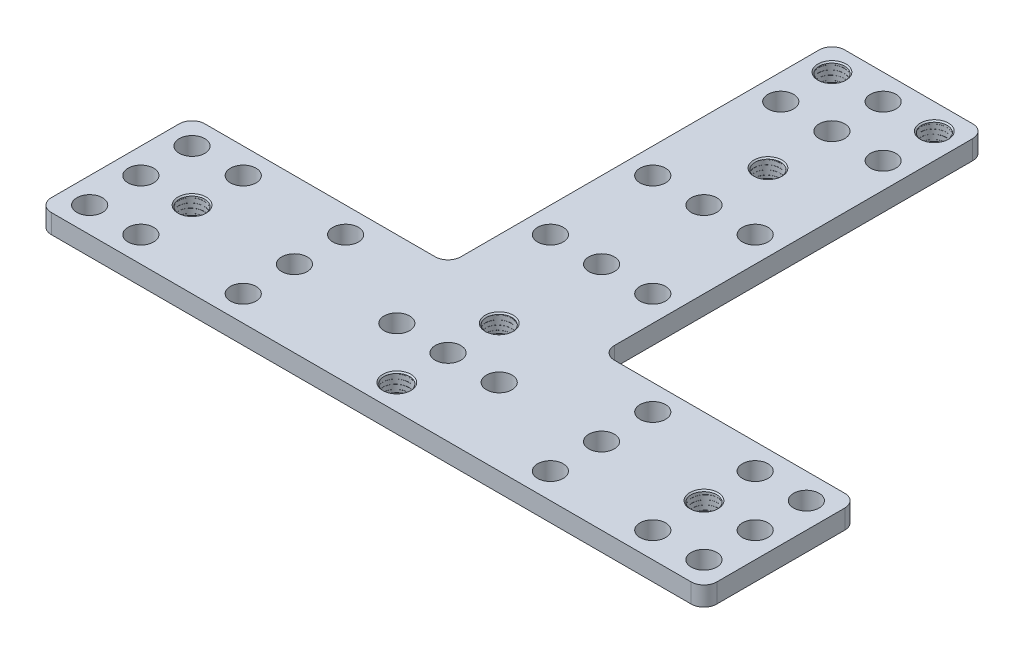
from build123d import *

# Parameters (mm, degrees)
SKETCH_1_R      = 2
EXTRUDE_1_DEPTH = 3
SWEEP_1_PITCH   = 0.7
SWEEP_2_PITCH   = 0.7
SWEEP_3_PITCH   = 0.7
SWEEP_4_PITCH   = 0.7
SWEEP_6_PITCH   = 0.7
SWEEP_5_PITCH   = 0.7
CHAMFER_1_SIZE  = 0.2


with BuildPart() as part:
    # 草图1 → 凸台-拉伸1 (new body)
    with BuildSketch(Plane(origin=(0, 0, 0), x_dir=(1, 0, 0), z_dir=(0, 1, 0))):
        with BuildLine():
            Line((-12, 14), (-12, 70))
            ThreePointArc((-12, 70), (-11.414213562, 71.414213562), (-10, 72))
            Line((-10, 72), (0, 72))
            Line((0, 72), (0, 70))
            ThreePointArc((0, 70), (-2, 68), (0, 66))
            Line((0, 66), (0, 62))
            ThreePointArc((0, 62), (-2, 60), (0, 58))
            Line((0, 58), (0, 52))
            ThreePointArc((0, 52), (-2, 50), (0, 48))
            Line((0, 48), (0, 42))
            ThreePointArc((0, 42), (-2, 40), (0, 38))
            Line((0, 38), (0, 26))
            ThreePointArc((0, 26), (-2, 24), (0, 22))
            Line((0, 22), (0, 10))
            ThreePointArc((0, 10), (-2, 8), (0, 6))
            Line((0, 6), (0, 2))
            ThreePointArc((0, 2), (-2, 0), (0, -2))
            Line((0, -2), (0, -6))
            ThreePointArc((0, -6), (-2, -8), (0, -10))
            Line((0, -10), (0, -12))
            Line((0, -12), (-50, -12))
            ThreePointArc((-50, -12), (-51.414213562, -11.414213562), (-52, -10))
            Line((-52, -10), (-52, 10))
            ThreePointArc((-52, 10), (-51.414213562, 11.414213562), (-50, 12))
            Line((-50, 12), (-14, 12))
            ThreePointArc((-14, 12), (-12.585786438, 12.585786438), (-12, 14))
        make_face()
        with Locations(Location((-8, 60, 0), (0, 0, 270))):
            Circle(SKETCH_1_R, mode=Mode.SUBTRACT)
        with Locations(Location((-48, 0, 0), (0, 0, 270))):
            Circle(SKETCH_1_R, mode=Mode.SUBTRACT)
        with Locations(Location((-48, -8, 0), (0, 0, 270))):
            Circle(SKETCH_1_R, mode=Mode.SUBTRACT)
        with Locations(Location((-40, -8, 0), (0, 0, 270))):
            Circle(SKETCH_1_R, mode=Mode.SUBTRACT)
        with Locations(Location((-40, 0, 0), (0, 0, 270))):
            Circle(SKETCH_1_R, mode=Mode.SUBTRACT)
        with Locations(Location((-48, 8, 0), (0, 0, 270))):
            Circle(SKETCH_1_R, mode=Mode.SUBTRACT)
        with Locations(Location((-40, 8, 0), (0, 0, 270))):
            Circle(SKETCH_1_R, mode=Mode.SUBTRACT)
        with Locations(Location((-8, 68, 0), (0, 0, 270))):
            Circle(SKETCH_1_R, mode=Mode.SUBTRACT)
        with Locations(Location((-8, 0, 0), (0, 0, 270))):
            Circle(SKETCH_1_R, mode=Mode.SUBTRACT)
        with Locations(Location((-8, 40, 0), (0, 0, 270))):
            Circle(SKETCH_1_R, mode=Mode.SUBTRACT)
        with Locations(Location((-24, 8, 0), (0, 0, 270))):
            Circle(SKETCH_1_R, mode=Mode.SUBTRACT)
        with Locations(Location((-24, -8, 0), (0, 0, 270))):
            Circle(SKETCH_1_R, mode=Mode.SUBTRACT)
        with Locations(Location((-8, 24, 0), (0, 0, 270))):
            Circle(SKETCH_1_R, mode=Mode.SUBTRACT)
        with Locations(Location((-24, 0, 0), (0, 0, 270))):
            Circle(SKETCH_1_R, mode=Mode.SUBTRACT)
    extrude_1 = extrude(amount=EXTRUDE_1_DEPTH)

    # 镜向1: 凸台-拉伸1 across plane
    add(extrude_1.mirror(Plane(origin=(0, 0, 0), x_dir=(0, 0, 1), z_dir=(1, 0, 0))))

    # 切除-扫描1: arcs per turn and ends read off the stored shape
    # 切除-扫描1: the profile of 草图8 screwed along a right-hand helix through 6 turns, 6 arcs to a turn; built about Z, then put on its axis
    sweep_1_z = Axis((0, 0, 0), (0, 0, 1))
    sweep_1_corners = [(2.01, 0, -0.7), (2, 0, -0.71), (1.99, 0, -0.7), (2, 0, -0.69)]
    with BuildLine(mode=Mode.PRIVATE) as sweep_1_profile:
        ThreePointArc((2.01, 0, -0.7), (2.007071068, 0, -0.707071068), (2, 0, -0.71))
        ThreePointArc((2, 0, -0.71), (1.992928932, 0, -0.707071068), (1.99, 0, -0.7))
        ThreePointArc((1.99, 0, -0.7), (1.992928932, 0, -0.692928932), (2, 0, -0.69))
        ThreePointArc((2, 0, -0.69), (2.007071068, 0, -0.692928932), (2.01, 0, -0.7))
    sweep_1_cap = Face(sweep_1_profile.wire())
    sweep_1_arcs = [((2.01, 0, -0.7), (2.01, 0, -0.71), (2, 0, -0.71), (1, 0.7071067811865477, 1)), ((2, 0, -0.71), (1.99, 0, -0.71), (1.99, 0, -0.7), (1, 0.7071067811865477, 1)), ((1.99, 0, -0.7), (1.99, 0, -0.69), (2, 0, -0.69), (1, 0.7071067811865477, 1)), ((2, 0, -0.69), (2.01, 0, -0.69), (2.01, 0, -0.7), (1, 0.7071067811865477, 1))]  # start, shoulder, end, weights
    sweep_1_turn_angles = [0, 30, 60, 90, 120, 150, 180, 210, 240, 270, 300, 330, 360]
    sweep_1_turn_weights = [1, 0.8660254037844387, 1, 0.8660254037844387, 1, 0.8660254037844387, 1, 0.8660254037844387, 1, 0.8660254037844387, 1, 0.8660254037844387, 1]
    sweep_1_turn_sides = [Face.make_bezier_surface([[Vector(p[j][0], p[j][1], 0).rotate(sweep_1_z, sweep_1_turn_angles[2 * i + k]) / sweep_1_turn_weights[2 * i + k] + Vector(0, 0, p[j][2] + SWEEP_1_PITCH * sweep_1_turn_angles[2 * i + k] / 360) for k in range(3)] for j in range(3)], [[p[3][j] * sweep_1_turn_weights[2 * i + k] for k in range(3)] for j in range(3)]) for p in sweep_1_arcs for i in range(6)]
    sweep_1 = Plane(origin=(-40, 3, 0), x_dir=(1, 0, 0), z_dir=(0, -1, 0)) * Solid(Shell([*[p.moved(Location((0, 0, SWEEP_1_PITCH * i))) for i in range(6) for p in sweep_1_turn_sides], sweep_1_cap, sweep_1_cap.rotate(sweep_1_z, 2160).moved(Location((0, 0, SWEEP_1_PITCH * 2160 / 360)))]))
    add(sweep_1, mode=Mode.SUBTRACT)

    # 切除-扫描2: arcs per turn and ends read off the stored shape
    # 切除-扫描2: the profile of 草图11 screwed along a right-hand helix through 6 turns, 6 arcs to a turn; built about Z, then put on its axis
    sweep_2_z = Axis((0, 0, 0), (0, 0, 1))
    sweep_2_corners = [(1.99, 0, -0.7), (2, 0, -0.71), (2.01, 0, -0.7), (2, 0, -0.69)]
    with BuildLine(mode=Mode.PRIVATE) as sweep_2_profile:
        ThreePointArc((1.99, 0, -0.7), (1.992928932, 0, -0.707071068), (2, 0, -0.71))
        ThreePointArc((2, 0, -0.71), (2.007071068, 0, -0.707071068), (2.01, 0, -0.7))
        ThreePointArc((2.01, 0, -0.7), (2.007071068, 0, -0.692928932), (2, 0, -0.69))
        ThreePointArc((2, 0, -0.69), (1.992928932, 0, -0.692928932), (1.99, 0, -0.7))
    sweep_2_cap = Face(sweep_2_profile.wire())
    sweep_2_arcs = [((1.99, 0, -0.7), (1.99, 0, -0.71), (2, 0, -0.71), (1, 0.7071067811865476, 1)), ((2, 0, -0.71), (2.01, 0, -0.71), (2.01, 0, -0.7), (1, 0.7071067811865476, 1)), ((2.01, 0, -0.7), (2.01, 0, -0.69), (2, 0, -0.69), (1, 0.7071067811865476, 1)), ((2, 0, -0.69), (1.99, 0, -0.69), (1.99, 0, -0.7), (1, 0.7071067811865476, 1))]  # start, shoulder, end, weights
    sweep_2_turn_angles = [0, 30, 60, 90, 120, 150, 180, 210, 240, 270, 300, 330, 360]
    sweep_2_turn_weights = [1, 0.8660254037844387, 1, 0.8660254037844387, 1, 0.8660254037844387, 1, 0.8660254037844387, 1, 0.8660254037844387, 1, 0.8660254037844387, 1]
    sweep_2_turn_sides = [Face.make_bezier_surface([[Vector(p[j][0], p[j][1], 0).rotate(sweep_2_z, sweep_2_turn_angles[2 * i + k]) / sweep_2_turn_weights[2 * i + k] + Vector(0, 0, p[j][2] + SWEEP_2_PITCH * sweep_2_turn_angles[2 * i + k] / 360) for k in range(3)] for j in range(3)], [[p[3][j] * sweep_2_turn_weights[2 * i + k] for k in range(3)] for j in range(3)]) for p in sweep_2_arcs for i in range(6)]
    sweep_2 = Plane(origin=(0, 3, -8), x_dir=(0, 0, 1), z_dir=(0, -1, 0)) * Solid(Shell([*[p.moved(Location((0, 0, SWEEP_2_PITCH * i))) for i in range(6) for p in sweep_2_turn_sides], sweep_2_cap, sweep_2_cap.rotate(sweep_2_z, 2160).moved(Location((0, 0, SWEEP_2_PITCH * 2160 / 360)))]))
    add(sweep_2, mode=Mode.SUBTRACT)

    # 切除-扫描3: arcs per turn and ends read off the stored shape
    # 切除-扫描3: the profile of 草图12 screwed along a right-hand helix through 6 turns, 6 arcs to a turn; built about Z, then put on its axis
    sweep_3_z = Axis((0, 0, 0), (0, 0, 1))
    sweep_3_corners = [(1.99, 0, -0.7), (2, 0, -0.71), (2.01, 0, -0.7), (2, 0, -0.69)]
    with BuildLine(mode=Mode.PRIVATE) as sweep_3_profile:
        ThreePointArc((1.99, 0, -0.7), (1.992928932, 0, -0.707071068), (2, 0, -0.71))
        ThreePointArc((2, 0, -0.71), (2.007071068, 0, -0.707071068), (2.01, 0, -0.7))
        ThreePointArc((2.01, 0, -0.7), (2.007071068, 0, -0.692928932), (2, 0, -0.69))
        ThreePointArc((2, 0, -0.69), (1.992928932, 0, -0.692928932), (1.99, 0, -0.7))
    sweep_3_cap = Face(sweep_3_profile.wire())
    sweep_3_arcs = [((1.99, 0, -0.7), (1.99, 0, -0.71), (2, 0, -0.71), (1, 0.7071067811865476, 1)), ((2, 0, -0.71), (2.01, 0, -0.71), (2.01, 0, -0.7), (1, 0.7071067811865476, 1)), ((2.01, 0, -0.7), (2.01, 0, -0.69), (2, 0, -0.69), (1, 0.7071067811865476, 1)), ((2, 0, -0.69), (1.99, 0, -0.69), (1.99, 0, -0.7), (1, 0.7071067811865476, 1))]  # start, shoulder, end, weights
    sweep_3_turn_angles = [0, 30, 60, 90, 120, 150, 180, 210, 240, 270, 300, 330, 360]
    sweep_3_turn_weights = [1, 0.8660254037844387, 1, 0.8660254037844387, 1, 0.8660254037844387, 1, 0.8660254037844387, 1, 0.8660254037844387, 1, 0.8660254037844387, 1]
    sweep_3_turn_sides = [Face.make_bezier_surface([[Vector(p[j][0], p[j][1], 0).rotate(sweep_3_z, sweep_3_turn_angles[2 * i + k]) / sweep_3_turn_weights[2 * i + k] + Vector(0, 0, p[j][2] + SWEEP_3_PITCH * sweep_3_turn_angles[2 * i + k] / 360) for k in range(3)] for j in range(3)], [[p[3][j] * sweep_3_turn_weights[2 * i + k] for k in range(3)] for j in range(3)]) for p in sweep_3_arcs for i in range(6)]
    sweep_3 = Plane(origin=(0, 3, 8), x_dir=(0, 0, 1), z_dir=(0, -1, 0)) * Solid(Shell([*[p.moved(Location((0, 0, SWEEP_3_PITCH * i))) for i in range(6) for p in sweep_3_turn_sides], sweep_3_cap, sweep_3_cap.rotate(sweep_3_z, 2160).moved(Location((0, 0, SWEEP_3_PITCH * 2160 / 360)))]))
    add(sweep_3, mode=Mode.SUBTRACT)

    # 切除-扫描4: arcs per turn and ends read off the stored shape
    # 切除-扫描4: the profile of 草图13 screwed along a right-hand helix through 6 turns, 6 arcs to a turn; built about Z, then put on its axis
    sweep_4_z = Axis((0, 0, 0), (0, 0, 1))
    sweep_4_corners = [(1.99, 0, -0.7), (2, 0, -0.71), (2.01, 0, -0.7), (2, 0, -0.69)]
    with BuildLine(mode=Mode.PRIVATE) as sweep_4_profile:
        ThreePointArc((1.99, 0, -0.7), (1.992928932, 0, -0.707071068), (2, 0, -0.71))
        ThreePointArc((2, 0, -0.71), (2.007071068, 0, -0.707071068), (2.01, 0, -0.7))
        ThreePointArc((2.01, 0, -0.7), (2.007071068, 0, -0.692928932), (2, 0, -0.69))
        ThreePointArc((2, 0, -0.69), (1.992928932, 0, -0.692928932), (1.99, 0, -0.7))
    sweep_4_cap = Face(sweep_4_profile.wire())
    sweep_4_arcs = [((1.99, 0, -0.7), (1.99, 0, -0.71), (2, 0, -0.71), (1, 0.7071067811865477, 1)), ((2, 0, -0.71), (2.01, 0, -0.71), (2.01, 0, -0.7), (1, 0.7071067811865477, 1)), ((2.01, 0, -0.7), (2.01, 0, -0.69), (2, 0, -0.69), (1, 0.7071067811865477, 1)), ((2, 0, -0.69), (1.99, 0, -0.69), (1.99, 0, -0.7), (1, 0.7071067811865477, 1))]  # start, shoulder, end, weights
    sweep_4_turn_angles = [0, 30, 60, 90, 120, 150, 180, 210, 240, 270, 300, 330, 360]
    sweep_4_turn_weights = [1, 0.8660254037844387, 1, 0.8660254037844387, 1, 0.8660254037844387, 1, 0.8660254037844387, 1, 0.8660254037844387, 1, 0.8660254037844387, 1]
    sweep_4_turn_sides = [Face.make_bezier_surface([[Vector(p[j][0], p[j][1], 0).rotate(sweep_4_z, sweep_4_turn_angles[2 * i + k]) / sweep_4_turn_weights[2 * i + k] + Vector(0, 0, p[j][2] + SWEEP_4_PITCH * sweep_4_turn_angles[2 * i + k] / 360) for k in range(3)] for j in range(3)], [[p[3][j] * sweep_4_turn_weights[2 * i + k] for k in range(3)] for j in range(3)]) for p in sweep_4_arcs for i in range(6)]
    sweep_4 = Plane(origin=(0, 3, -50), x_dir=(0, 0, 1), z_dir=(0, -1, 0)) * Solid(Shell([*[p.moved(Location((0, 0, SWEEP_4_PITCH * i))) for i in range(6) for p in sweep_4_turn_sides], sweep_4_cap, sweep_4_cap.rotate(sweep_4_z, 2160).moved(Location((0, 0, SWEEP_4_PITCH * 2160 / 360)))]))
    add(sweep_4, mode=Mode.SUBTRACT)

    # 切除-扫描6: arcs per turn and ends read off the stored shape
    # 切除-扫描6: the profile of 草图15 screwed along a right-hand helix through 6 turns, 6 arcs to a turn; built about Z, then put on its axis
    sweep_6_z = Axis((0, 0, 0), (0, 0, 1))
    sweep_6_corners = [(1.99, 0, -0.7), (2, 0, -0.71), (2.01, 0, -0.7), (2, 0, -0.69)]
    with BuildLine(mode=Mode.PRIVATE) as sweep_6_profile:
        ThreePointArc((1.99, 0, -0.7), (1.992928932, 0, -0.707071068), (2, 0, -0.71))
        ThreePointArc((2, 0, -0.71), (2.007071068, 0, -0.707071068), (2.01, 0, -0.7))
        ThreePointArc((2.01, 0, -0.7), (2.007071068, 0, -0.692928932), (2, 0, -0.69))
        ThreePointArc((2, 0, -0.69), (1.992928932, 0, -0.692928932), (1.99, 0, -0.7))
    sweep_6_cap = Face(sweep_6_profile.wire())
    sweep_6_arcs = [((1.99, 0, -0.7), (1.99, 0, -0.71), (2, 0, -0.71), (1, 0.7071067811865476, 1)), ((2, 0, -0.71), (2.01, 0, -0.71), (2.01, 0, -0.7), (1, 0.7071067811865476, 1)), ((2.01, 0, -0.7), (2.01, 0, -0.69), (2, 0, -0.69), (1, 0.7071067811865476, 1)), ((2, 0, -0.69), (1.99, 0, -0.69), (1.99, 0, -0.7), (1, 0.7071067811865476, 1))]  # start, shoulder, end, weights
    sweep_6_turn_angles = [0, 30, 60, 90, 120, 150, 180, 210, 240, 270, 300, 330, 360]
    sweep_6_turn_weights = [1, 0.8660254037844387, 1, 0.8660254037844387, 1, 0.8660254037844387, 1, 0.8660254037844387, 1, 0.8660254037844387, 1, 0.8660254037844387, 1]
    sweep_6_turn_sides = [Face.make_bezier_surface([[Vector(p[j][0], p[j][1], 0).rotate(sweep_6_z, sweep_6_turn_angles[2 * i + k]) / sweep_6_turn_weights[2 * i + k] + Vector(0, 0, p[j][2] + SWEEP_6_PITCH * sweep_6_turn_angles[2 * i + k] / 360) for k in range(3)] for j in range(3)], [[p[3][j] * sweep_6_turn_weights[2 * i + k] for k in range(3)] for j in range(3)]) for p in sweep_6_arcs for i in range(6)]
    sweep_6 = Plane(origin=(-8, 3, -68), x_dir=(1, 0, 0), z_dir=(0, -1, 0)) * Solid(Shell([*[p.moved(Location((0, 0, SWEEP_6_PITCH * i))) for i in range(6) for p in sweep_6_turn_sides], sweep_6_cap, sweep_6_cap.rotate(sweep_6_z, 2160).moved(Location((0, 0, SWEEP_6_PITCH * 2160 / 360)))]))
    add(sweep_6, mode=Mode.SUBTRACT)

    # 切除-扫描5: arcs per turn and ends read off the stored shape
    # 切除-扫描5: the profile of 草图14 screwed along a right-hand helix through 6 turns, 6 arcs to a turn; built about Z, then put on its axis
    sweep_5_z = Axis((0, 0, 0), (0, 0, 1))
    sweep_5_corners = [(1.99, 0, -0.7), (2, 0, -0.71), (2.01, 0, -0.7), (2, 0, -0.69)]
    with BuildLine(mode=Mode.PRIVATE) as sweep_5_profile:
        ThreePointArc((1.99, 0, -0.7), (1.992928932, 0, -0.707071068), (2, 0, -0.71))
        ThreePointArc((2, 0, -0.71), (2.007071068, 0, -0.707071068), (2.01, 0, -0.7))
        ThreePointArc((2.01, 0, -0.7), (2.007071068, 0, -0.692928932), (2, 0, -0.69))
        ThreePointArc((2, 0, -0.69), (1.992928932, 0, -0.692928932), (1.99, 0, -0.7))
    sweep_5_cap = Face(sweep_5_profile.wire())
    sweep_5_arcs = [((1.99, 0, -0.7), (1.99, 0, -0.71), (2, 0, -0.71), (1, 0.7071067811865476, 1)), ((2, 0, -0.71), (2.01, 0, -0.71), (2.01, 0, -0.7), (1, 0.7071067811865476, 1)), ((2.01, 0, -0.7), (2.01, 0, -0.69), (2, 0, -0.69), (1, 0.7071067811865476, 1)), ((2, 0, -0.69), (1.99, 0, -0.69), (1.99, 0, -0.7), (1, 0.7071067811865476, 1))]  # start, shoulder, end, weights
    sweep_5_turn_angles = [0, 30, 60, 90, 120, 150, 180, 210, 240, 270, 300, 330, 360]
    sweep_5_turn_weights = [1, 0.8660254037844387, 1, 0.8660254037844387, 1, 0.8660254037844387, 1, 0.8660254037844387, 1, 0.8660254037844387, 1, 0.8660254037844387, 1]
    sweep_5_turn_sides = [Face.make_bezier_surface([[Vector(p[j][0], p[j][1], 0).rotate(sweep_5_z, sweep_5_turn_angles[2 * i + k]) / sweep_5_turn_weights[2 * i + k] + Vector(0, 0, p[j][2] + SWEEP_5_PITCH * sweep_5_turn_angles[2 * i + k] / 360) for k in range(3)] for j in range(3)], [[p[3][j] * sweep_5_turn_weights[2 * i + k] for k in range(3)] for j in range(3)]) for p in sweep_5_arcs for i in range(6)]
    sweep_5 = Plane(origin=(8, 3, -68), x_dir=(1, 0, 0), z_dir=(0, -1, 0)) * Solid(Shell([*[p.moved(Location((0, 0, SWEEP_5_PITCH * i))) for i in range(6) for p in sweep_5_turn_sides], sweep_5_cap, sweep_5_cap.rotate(sweep_5_z, 2160).moved(Location((0, 0, SWEEP_5_PITCH * 2160 / 360)))]))
    add(sweep_5, mode=Mode.SUBTRACT)

    # 镜向2: 切除-扫描1 across plane
    add(sweep_1.mirror(Plane(origin=(0, 0, 0), x_dir=(0, 0, 1), z_dir=(1, 0, 0))), mode=Mode.SUBTRACT)

    # 倒角1
    # the kernel refuses this chamfer: 0.2 mm, written as the material it takes off along each edge
    with BuildSketch(Plane(origin=(-40, 3, 0), x_dir=(0.9869676680405628, 0, 0.16091868208065052), z_dir=(-0.16091868208065052, 0, 0.9869676680405628))) as chamfer_1_piece_1:
        Polygon((2 + CHAMFER_1_SIZE, 0), (2, -CHAMFER_1_SIZE), (2, 0), align=None)
    revolve(axis=Axis((-40, 3, 0), (0, 1, 0)), revolution_arc=279.260223824, mode=Mode.SUBTRACT)
    with BuildSketch(Plane(origin=(-8, 3, -68), x_dir=(0.9869676680405632, 0, 0.16091868208064816), z_dir=(-0.16091868208064816, 0, 0.9869676680405632))) as chamfer_1_piece_2:
        Polygon((2 + CHAMFER_1_SIZE, 0), (2, -CHAMFER_1_SIZE), (2, 0), align=None)
    revolve(axis=Axis((-8, 3, -68), (0, 1, 0)), revolution_arc=279.260223824, mode=Mode.SUBTRACT)
    with BuildSketch(Plane(origin=(8, 3, -68), x_dir=(0, 0, 1), z_dir=(1, 0, 0))) as chamfer_1_piece_3:
        Polygon((2 + CHAMFER_1_SIZE, 0), (2, CHAMFER_1_SIZE), (2, 0), align=None)
    revolve(axis=Axis((8, 3, -68), (0, -1, 0)), revolution_arc=279.260223824, mode=Mode.SUBTRACT)
    with BuildSketch(Plane(origin=(0, 3, -50), x_dir=(0, 0, -1), z_dir=(-1, 0, 0))) as chamfer_1_piece_4:
        Polygon((2 + CHAMFER_1_SIZE, 0), (2, CHAMFER_1_SIZE), (2, 0), align=None)
    revolve(axis=Axis((0, 3, -50), (0, -1, 0)), revolution_arc=189.231262789, mode=Mode.SUBTRACT)
    with BuildSketch(Plane(origin=(40, 3, 0), x_dir=(-0.9869676680405628, 0, 0.16091868208065052), z_dir=(0.16091868208065052, 0, 0.9869676680405628))) as chamfer_1_piece_5:
        Polygon((2 + CHAMFER_1_SIZE, 0), (2, CHAMFER_1_SIZE), (2, 0), align=None)
    revolve(axis=Axis((40, 3, 0), (0, -1, 0)), revolution_arc=279.260223824, mode=Mode.SUBTRACT)
    with BuildSketch(Plane(origin=(0, 3, 8), x_dir=(0, 0, -1), z_dir=(-1, 0, 0))) as chamfer_1_piece_6:
        Polygon((2 + CHAMFER_1_SIZE, 0), (2, CHAMFER_1_SIZE), (2, 0), align=None)
    revolve(axis=Axis((0, 3, 8), (0, -1, 0)), revolution_arc=189.231262789, mode=Mode.SUBTRACT)
    with BuildSketch(Plane(origin=(0, 3, -8), x_dir=(0, 0, -1), z_dir=(-1, 0, 0))) as chamfer_1_piece_7:
        Polygon((2 + CHAMFER_1_SIZE, 0), (2, CHAMFER_1_SIZE), (2, 0), align=None)
    revolve(axis=Axis((0, 3, -8), (0, -1, 0)), revolution_arc=189.231262789, mode=Mode.SUBTRACT)
    with BuildSketch(Plane(origin=(0, 3, -8), x_dir=(0.16041978352342934, 0, 0.9870488807826572), z_dir=(0.9870488807826572, 0, -0.16041978352342934))) as chamfer_1_piece_8:
        Polygon((2 + CHAMFER_1_SIZE, 0), (2, CHAMFER_1_SIZE), (2, 0), align=None)
    revolve(axis=Axis((0, 3, -8), (0, -1, 0)), revolution_arc=189.231262789, mode=Mode.SUBTRACT)
    with BuildSketch(Plane(origin=(0, 3, 8), x_dir=(0.16041978352342526, 0, 0.9870488807826578), z_dir=(0.9870488807826578, 0, -0.16041978352342526))) as chamfer_1_piece_9:
        Polygon((2 + CHAMFER_1_SIZE, 0), (2, CHAMFER_1_SIZE), (2, 0), align=None)
    revolve(axis=Axis((0, 3, 8), (0, -1, 0)), revolution_arc=189.231262789, mode=Mode.SUBTRACT)
    with BuildSketch(Plane(origin=(40, 3, 0), x_dir=(0, 0, 1), z_dir=(1, 0, 0))) as chamfer_1_piece_10:
        Polygon((2 + CHAMFER_1_SIZE, 0), (2, CHAMFER_1_SIZE), (2, 0), align=None)
    revolve(axis=Axis((40, 3, 0), (0, -1, 0)), revolution_arc=99.214215066, mode=Mode.SUBTRACT)
    with BuildSketch(Plane(origin=(0, 3, -50), x_dir=(0.1604197835234172, 0, 0.9870488807826592), z_dir=(0.9870488807826592, 0, -0.1604197835234172))) as chamfer_1_piece_11:
        Polygon((2 + CHAMFER_1_SIZE, 0), (2, CHAMFER_1_SIZE), (2, 0), align=None)
    revolve(axis=Axis((0, 3, -50), (0, -1, 0)), revolution_arc=189.231262789, mode=Mode.SUBTRACT)
    with BuildSketch(Plane(origin=(8, 3, -68), x_dir=(0.9870965682170658, 0, -0.16012609098486028), z_dir=(-0.16012609098486028, 0, -0.9870965682170658))) as chamfer_1_piece_12:
        Polygon((2 + CHAMFER_1_SIZE, 0), (2, CHAMFER_1_SIZE), (2, 0), align=None)
    revolve(axis=Axis((8, 3, -68), (0, -1, 0)), revolution_arc=99.214215066, mode=Mode.SUBTRACT)
    with BuildSketch(Plane(origin=(-8, 3, -68), x_dir=(0, 0, 1), z_dir=(-1, 0, 0))) as chamfer_1_piece_13:
        Polygon((2 + CHAMFER_1_SIZE, 0), (2, -CHAMFER_1_SIZE), (2, 0), align=None)
    revolve(axis=Axis((-8, 3, -68), (0, 1, 0)), revolution_arc=99.214215066, mode=Mode.SUBTRACT)
    with BuildSketch(Plane(origin=(-40, 3, 0), x_dir=(0, 0, 1), z_dir=(-1, 0, 0))) as chamfer_1_piece_14:
        Polygon((2 + CHAMFER_1_SIZE, 0), (2, -CHAMFER_1_SIZE), (2, 0), align=None)
    revolve(axis=Axis((-40, 3, 0), (0, 1, 0)), revolution_arc=99.214215066, mode=Mode.SUBTRACT)

    # 倒角2: read off the stored shape, not the designer's step
    # 倒角2: loft between two sections, ruled curve by curve
    chamfer_2_from = [
        Edge.make_three_point_arc((38.009293857, 0.200000214, -0.192582955), (40.192582955, 0.200000214, -1.990706143), (41.990706143, 0.200000214, 0.192582955)),
        Edge.make_three_point_arc((41.990706143, 0.200000214, 0.192582955), (39.807417045, 0.200000214, 1.990706143), (38.009293857, 0.200000214, -0.192582955)),
    ]
    chamfer_2_to = [
        Edge.make_three_point_arc((37.810223008, 0, -0.211841274), (40.211841274, 0, -2.189776992), (42.189776992, 0, 0.211841274)),
        Edge.make_three_point_arc((42.189776992, 0, 0.211841274), (39.788158726, 0, 2.189776992), (37.810223008, 0, -0.211841274)),
    ]
    chamfer_2 = Solid(Shell([*[Face.make_surface_from_curves(chamfer_2_from[k], chamfer_2_to[k]) for k in range(2)], Face(Wire(chamfer_2_from)), Face(Wire(chamfer_2_to))]))
    add(chamfer_2, mode=Mode.SUBTRACT)

    # Chamfer 2 2: loft between two sections, ruled curve by curve
    chamfer_2_2_from = [
        Edge.make_three_point_arc((0.192582976, 0.2, 9.990706356), (-1.990706356, 0.2, 8.192582976), (-0.192582976, 0.2, 6.009293644)),
        Edge.make_three_point_arc((-0.192582976, 0.2, 6.009293644), (1.990706356, 0.2, 7.807417024), (0.192582976, 0.2, 9.990706356)),
    ]
    chamfer_2_2_to = [
        Edge.make_three_point_arc((0.211841274, 0, 10.189776992), (-2.189776992, 0, 8.211841274), (-0.211841274, 0, 5.810223008)),
        Edge.make_three_point_arc((-0.211841274, 0, 5.810223008), (2.189776992, 0, 7.788158726), (0.211841274, 0, 10.189776992)),
    ]
    chamfer_2_2 = Solid(Shell([*[Face.make_surface_from_curves(chamfer_2_2_from[k], chamfer_2_2_to[k]) for k in range(2)], Face(Wire(chamfer_2_2_from)), Face(Wire(chamfer_2_2_to))]))
    add(chamfer_2_2, mode=Mode.SUBTRACT)

    # Chamfer 2 3: loft between two sections, ruled curve by curve
    chamfer_2_3_from = [
        Edge.make_three_point_arc((0.192582976, 0.2, -6.009293644), (-1.990706356, 0.2, -7.807417024), (-0.192582976, 0.2, -9.990706356)),
        Edge.make_three_point_arc((-0.192582976, 0.2, -9.990706356), (1.990706356, 0.2, -8.192582976), (0.192582976, 0.2, -6.009293644)),
    ]
    chamfer_2_3_to = [
        Edge.make_three_point_arc((0.211841274, 0, -5.810223008), (-2.189776992, 0, -7.788158726), (-0.211841274, 0, -10.189776992)),
        Edge.make_three_point_arc((-0.211841274, 0, -10.189776992), (2.189776992, 0, -8.211841274), (0.211841274, 0, -5.810223008)),
    ]
    chamfer_2_3 = Solid(Shell([*[Face.make_surface_from_curves(chamfer_2_3_from[k], chamfer_2_3_to[k]) for k in range(2)], Face(Wire(chamfer_2_3_from)), Face(Wire(chamfer_2_3_to))]))
    add(chamfer_2_3, mode=Mode.SUBTRACT)

    # Chamfer 2 4: loft between two sections, ruled curve by curve
    chamfer_2_4_from = [
        Edge.make_three_point_arc((-38.009293644, 0.2, -0.192582976), (-39.807417024, 0.2, 1.990706356), (-41.990706356, 0.2, 0.192582976)),
        Edge.make_three_point_arc((-41.990706356, 0.2, 0.192582976), (-40.192582976, 0.2, -1.990706356), (-38.009293644, 0.2, -0.192582976)),
    ]
    chamfer_2_4_to = [
        Edge.make_three_point_arc((-37.810223008, 0, -0.211841274), (-39.788158726, 0, 2.189776992), (-42.189776992, 0, 0.211841274)),
        Edge.make_three_point_arc((-42.189776992, 0, 0.211841274), (-40.211841274, 0, -2.189776992), (-37.810223008, 0, -0.211841274)),
    ]
    chamfer_2_4 = Solid(Shell([*[Face.make_surface_from_curves(chamfer_2_4_from[k], chamfer_2_4_to[k]) for k in range(2)], Face(Wire(chamfer_2_4_from)), Face(Wire(chamfer_2_4_to))]))
    add(chamfer_2_4, mode=Mode.SUBTRACT)

    # Chamfer 2 5: loft between two sections, ruled curve by curve
    chamfer_2_5_from = [
        Edge.make_three_point_arc((0.192582976, 0.2, -48.009293644), (-1.990706356, 0.2, -49.807417024), (-0.192582976, 0.2, -51.990706356)),
        Edge.make_three_point_arc((-0.192582976, 0.2, -51.990706356), (1.990706356, 0.2, -50.192582976), (0.192582976, 0.2, -48.009293644)),
    ]
    chamfer_2_5_to = [
        Edge.make_three_point_arc((0.211841274, 0, -47.810223008), (-2.189776992, 0, -49.788158726), (-0.211841274, 0, -52.189776992)),
        Edge.make_three_point_arc((-0.211841274, 0, -52.189776992), (2.189776992, 0, -50.211841274), (0.211841274, 0, -47.810223008)),
    ]
    chamfer_2_5 = Solid(Shell([*[Face.make_surface_from_curves(chamfer_2_5_from[k], chamfer_2_5_to[k]) for k in range(2)], Face(Wire(chamfer_2_5_from)), Face(Wire(chamfer_2_5_to))]))
    add(chamfer_2_5, mode=Mode.SUBTRACT)

    # Chamfer 2 6: loft between two sections, ruled curve by curve
    chamfer_2_6_from = [
        Edge.make_three_point_arc((9.990706356, 0.2, -68.192582976), (8.192582976, 0.2, -66.009293644), (6.009293644, 0.2, -67.807417024)),
        Edge.make_three_point_arc((6.009293644, 0.2, -67.807417024), (7.807417024, 0.2, -69.990706356), (9.990706356, 0.2, -68.192582976)),
    ]
    chamfer_2_6_to = [
        Edge.make_three_point_arc((10.189776992, 0, -68.211841274), (8.211841274, 0, -65.810223008), (5.810223008, 0, -67.788158726)),
        Edge.make_three_point_arc((5.810223008, 0, -67.788158726), (7.788158726, 0, -70.189776992), (10.189776992, 0, -68.211841274)),
    ]
    chamfer_2_6 = Solid(Shell([*[Face.make_surface_from_curves(chamfer_2_6_from[k], chamfer_2_6_to[k]) for k in range(2)], Face(Wire(chamfer_2_6_from)), Face(Wire(chamfer_2_6_to))]))
    add(chamfer_2_6, mode=Mode.SUBTRACT)

    # Chamfer 2 7: loft between two sections, ruled curve by curve
    chamfer_2_7_from = [
        Edge.make_three_point_arc((-6.009293644, 0.2, -68.192582976), (-7.807417024, 0.2, -66.009293644), (-9.990706356, 0.2, -67.807417024)),
        Edge.make_three_point_arc((-9.990706356, 0.2, -67.807417024), (-8.192582976, 0.2, -69.990706356), (-6.009293644, 0.2, -68.192582976)),
    ]
    chamfer_2_7_to = [
        Edge.make_three_point_arc((-5.810223008, 0, -68.211841274), (-7.788158726, 0, -65.810223008), (-10.189776992, 0, -67.788158726)),
        Edge.make_three_point_arc((-10.189776992, 0, -67.788158726), (-8.211841274, 0, -70.189776992), (-5.810223008, 0, -68.211841274)),
    ]
    chamfer_2_7 = Solid(Shell([*[Face.make_surface_from_curves(chamfer_2_7_from[k], chamfer_2_7_to[k]) for k in range(2)], Face(Wire(chamfer_2_7_from)), Face(Wire(chamfer_2_7_to))]))
    add(chamfer_2_7, mode=Mode.SUBTRACT)


solid = part.part
